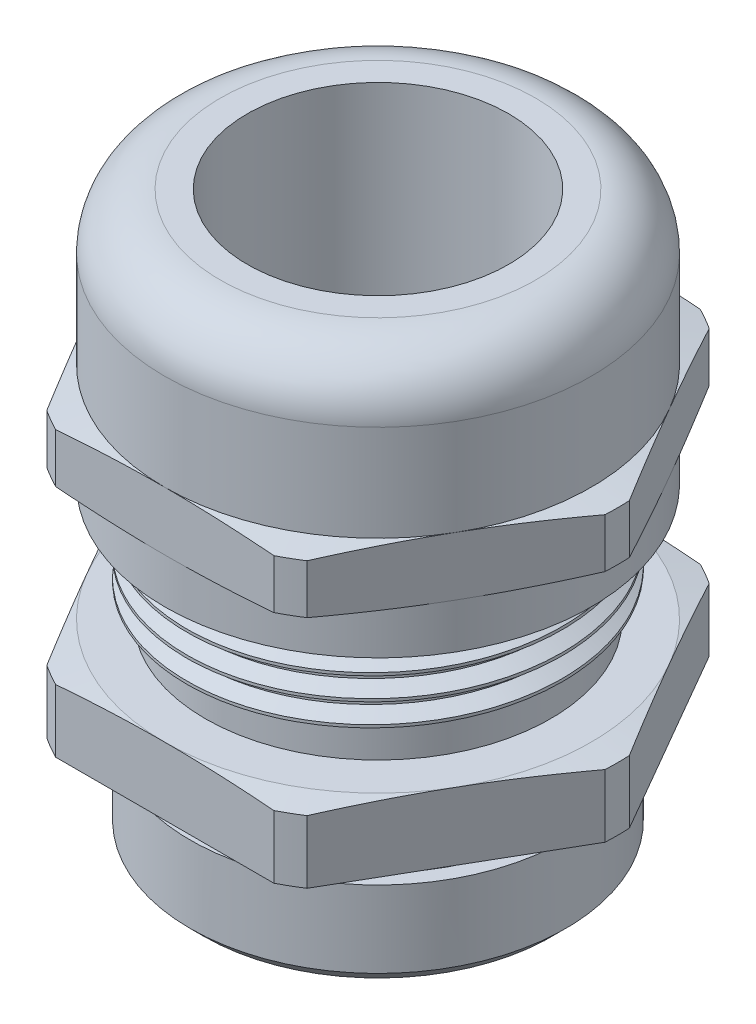
from build123d import *

# Parameters (mm, degrees)
SKETCH2_R        = 33.244454728
EXTRUDE1_DEPTH   = 44.590079147
CHAMFER2_SIZE    = 0.9
CUT_SWEEP1_PITCH = 1.5


with BuildPart() as part:
    # Sketch1 → Revolve1 (revolve)
    with BuildSketch(Plane.XY, mode=Mode.PRIVATE) as revolve1_sk:
        with BuildLine():
            Line((-8.7, 34.639140794), (-10.5, 34.639140794))
            ThreePointArc((-10.5, 34.639140794), (-13.11629509, 33.555435885), (-14.2, 30.939140794))
            Line((-14.2, 30.939140794), (-14.2, 24.539140794))
            Line((-14.2, 24.539140794), (-15.95, 24.230568578))
            Line((-15.95, 24.230568578), (-15.95, 20.947713011))
            Line((-15.95, 20.947713011), (-14.2, 20.639140794))
            Line((-14.2, 20.639140794), (-14.2, 17.639140794))
            Line((-14.2, 17.639140794), (-12.6, 17.639140794))
            Line((-12.6, 17.639140794), (-12.6, 19.639140794))
            Line((-12.6, 19.639140794), (-12.5, 19.639140794))
            Line((-12.5, 19.639140794), (-12.5, 11.839140794))
            Line((-12.5, 11.839140794), (-11.5, 11.839140794))
            Line((-11.5, 11.839140794), (-11.5, 9.839140794))
            Line((-11.5, 9.839140794), (-14.2, 9.839140794))
            Line((-14.2, 9.839140794), (-15.95, 9.530568578))
            Line((-15.95, 9.530568578), (-15.95, 5.339140794))
            Line((-15.95, 5.339140794), (-11.5, 5.339140794))
            Line((-11.5, 5.339140794), (-11.5, 3.339140794))
            Line((-11.5, 3.339140794), (-12.5, 3.339140794))
            Line((-12.5, 3.339140794), (-12.5, -2.660859206))
            Line((-12.5, -2.660859206), (-10, -2.660859206))
            Line((-10, -2.660859206), (-10, 15.039140794))
            Line((-10, 15.039140794), (-8.7, 15.039140794))
            Line((-8.7, 15.039140794), (-8.7, 34.639140794))
        make_face()
    revolve(revolve1_sk.sketch.rotate(Axis((0, 0, 0), (0, 1, 0)), 270), axis=Axis((0, 0, 0), (0, 1, 0)))

    # Sketch2 → Extrude1 (cut, through all)
    with BuildSketch(Plane(origin=(0, 34.639140794, 0), x_dir=(1, 0, 0), z_dir=(0, 1, 0))):
        Circle(SKETCH2_R)
        Polygon((-16.396747645, 0), (-8.198373822, -14.2), (8.198373822, -14.2), (16.396747645, 0), (8.198373822, 14.2), (-8.198373822, 14.2), align=None, mode=Mode.SUBTRACT)
    extrude(amount=-EXTRUDE1_DEPTH, mode=Mode.SUBTRACT)

    # Chamfer2
    chamfer2_edges = [part.edges().sort_by_distance(p)[0] for p in [
        (0, -2.660859206, 12.5),
    ]]
    chamfer(chamfer2_edges, length=CHAMFER2_SIZE)

    # Cut-Sweep1: arcs per turn and ends read off the stored shape
    # Cut-Sweep1: the profile of Sketch11 screwed along a right-hand helix through 6.25 turns, 8 arcs to a turn; built about Z, then put on its axis
    cut_sweep1_z = Axis((0, 0, 0), (0, 0, 1))
    cut_sweep1_corners = [(0.181809613, -11.5930896, -0.894529057), (0.186902044, -11.5930896, -1.161168155), (0.196886995, -12.4987896, -1.683978953), (0.197841751, -12.58539214, -1.733969837), (0.170869906, -12.58539214, -0.321727376), (0.171824662, -12.4987896, -0.371718259)]
    with BuildLine(mode=Mode.PRIVATE) as cut_sweep1_profile:
        Line(cut_sweep1_corners[0], cut_sweep1_corners[1])
        Line(cut_sweep1_corners[1], cut_sweep1_corners[2])
        Line(cut_sweep1_corners[2], cut_sweep1_corners[3])
        Line(cut_sweep1_corners[3], cut_sweep1_corners[4])
        Line(cut_sweep1_corners[4], cut_sweep1_corners[5])
        Line(cut_sweep1_corners[5], cut_sweep1_corners[0])
    cut_sweep1_cap = Face(cut_sweep1_profile.wire())
    cut_sweep1_turn_angles = [0, 22.5, 45, 67.5, 90, 112.5, 135, 157.5, 180, 202.5, 225, 247.5, 270, 292.5, 315, 337.5, 360]
    cut_sweep1_turn_weights = [1, 0.9238795325112867, 1, 0.9238795325112867, 1, 0.9238795325112867, 1, 0.9238795325112867, 1, 0.9238795325112867, 1, 0.9238795325112867, 1, 0.9238795325112867, 1, 0.9238795325112867, 1]
    cut_sweep1_turn_rails = [Edge.make_bspline([Vector(p[0], p[1], 0).rotate(cut_sweep1_z, cut_sweep1_turn_angles[k]) / cut_sweep1_turn_weights[k] + Vector(0, 0, p[2] + CUT_SWEEP1_PITCH * cut_sweep1_turn_angles[k] / 360) for k in range(17)], [0, 0, 0, 1, 1, 2, 2, 3, 3, 4, 4, 5, 5, 6, 6, 7, 7, 8, 8, 8], 2, cut_sweep1_turn_weights) for p in cut_sweep1_corners]
    cut_sweep1_turn_sides = [Face.make_surface_from_curves(cut_sweep1_turn_rails[p[0]], cut_sweep1_turn_rails[p[1]]) for p in [(0, 1), (1, 2), (2, 3), (3, 4), (4, 5), (5, 0)]]
    cut_sweep1_last_angles = [2160, 2182.5, 2205, 2227.5, 2250]
    cut_sweep1_last_weights = [1, 0.9238795325112867, 1, 0.9238795325112867, 1]
    cut_sweep1_last_rails = [Edge.make_bspline([Vector(p[0], p[1], 0).rotate(cut_sweep1_z, cut_sweep1_last_angles[k]) / cut_sweep1_last_weights[k] + Vector(0, 0, p[2] + CUT_SWEEP1_PITCH * cut_sweep1_last_angles[k] / 360) for k in range(5)], [0, 0, 0, 1, 1, 2, 2, 2], 2, cut_sweep1_last_weights) for p in cut_sweep1_corners]
    cut_sweep1_last_sides = [Face.make_surface_from_curves(cut_sweep1_last_rails[p[0]], cut_sweep1_last_rails[p[1]]) for p in [(0, 1), (1, 2), (2, 3), (3, 4), (4, 5), (5, 0)]]
    cut_sweep1 = Plane(origin=(0, 11.839140794, 0), x_dir=(-1, 0, 0), z_dir=(0, 1, 0)) * Solid(Shell([*[p.moved(Location((0, 0, CUT_SWEEP1_PITCH * i))) for i in range(6) for p in cut_sweep1_turn_sides], *cut_sweep1_last_sides, cut_sweep1_cap, cut_sweep1_cap.rotate(cut_sweep1_z, 2250).moved(Location((0, 0, CUT_SWEEP1_PITCH * 2250 / 360)))]))
    add(cut_sweep1, mode=Mode.SUBTRACT)


solid = part.part
